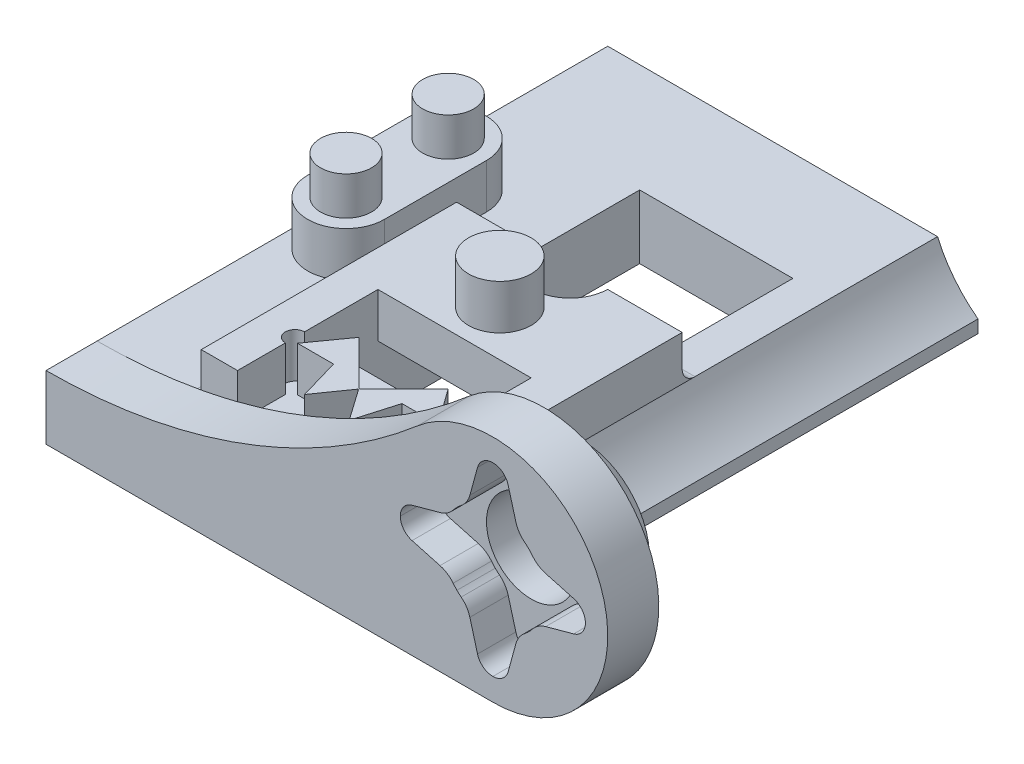
from build123d import *

# Parameters (mm, degrees)
SKETCH1_R           = 9
BOSS_EXTRUDE1_DEPTH = 4
SKETCH2_R           = 7
BOSS_EXTRUDE2_DEPTH = 3
BOSS_EXTRUDE2_TAPER = 30
CUT_EXTRUDE1_DEPTH  = 3
BOSS_EXTRUDE3_DEPTH = 40
SKETCH6_W           = 12
SKETCH6_H           = 23
CUT_EXTRUDE2_DEPTH  = 55.717456081
BOSS_EXTRUDE4_DEPTH = 3.5
SKETCH8_R           = 2
BOSS_EXTRUDE5_DEPTH = 3
SKETCH9_R           = 3.5
CUT_EXTRUDE3_DEPTH  = 52.720402164
BOSS_EXTRUDE6_DEPTH = 3.5
SKETCH11_R          = 2.45
BOSS_EXTRUDE7_DEPTH = 3.5
BOSS_EXTRUDE8_DEPTH = 3.5
FILLET3_START       = -26.84
FILLET3_DEPTH       = 2.84
FILLET3_START_2     = -12
FILLET3_2_DEPTH     = 2.83
FILLET3_START_3     = -21
FILLET3_3_DEPTH     = 21
FILLET3_START_4     = -27.84
FILLET3_4_DEPTH     = 1


with BuildPart() as part:
    # Sketch1 → Boss-Extrude1 (new body)
    with BuildSketch(Plane.XY):
        with BuildLine():
            Line((-35, -9), (0, -9))
            ThreePointArc((0, -9), (-8.437416666, -3.132091953), (-5.872614409, 6.82))
            ThreePointArc((-5.872614409, 6.82), (-19.465199243, -1.204217751), (-35, -4))
            Line((-35, -4), (-35, -9))
        make_face()
        Circle(SKETCH1_R)
    extrude(amount=BOSS_EXTRUDE1_DEPTH)

    # Sketch2 → Boss-Extrude2 (add)
    with BuildSketch(Plane(origin=(0, 0, 0), x_dir=(-1, 0, 0), z_dir=(0, 0, -1))):
        Circle(SKETCH2_R)
    extrude(amount=BOSS_EXTRUDE2_DEPTH, taper=BOSS_EXTRUDE2_TAPER)

    # Sketch4 → Cut-Extrude1 (cut)
    with BuildSketch(Plane.XY.offset(4)):
        with BuildLine():
            Line((1.2, -6.33), (1.8, -4.1378116))
            ThreePointArc((1.8, -4.1378116), (2.058560194, -3.569045514), (2.48, -3.1078116))
            ThreePointArc((2.48, -3.1078116), (2.64989874, -2.964295475), (2.811558399, -2.811558399))
            ThreePointArc((2.811558399, -2.811558399), (2.964295475, -2.64989874), (3.1078116, -2.48))
            ThreePointArc((3.1078116, -2.48), (3.569045514, -2.058560194), (4.1378116, -1.8))
            Line((4.1378116, -1.8), (6.33, -1.2))
            ThreePointArc((6.33, -1.2), (6.992020752, -0.754882576), (7.25, 0))
            ThreePointArc((7.25, 0), (6.992020752, 0.754882576), (6.33, 1.2))
            Line((6.33, 1.2), (4.1378116, 1.8))
            ThreePointArc((4.1378116, 1.8), (3.569045514, 2.058560194), (3.1078116, 2.48))
            ThreePointArc((3.1078116, 2.48), (2.964295475, 2.64989874), (2.811558399, 2.811558399))
            ThreePointArc((2.811558399, 2.811558399), (2.64989874, 2.964295475), (2.48, 3.1078116))
            ThreePointArc((2.48, 3.1078116), (2.058560194, 3.569045514), (1.8, 4.1378116))
            Line((1.8, 4.1378116), (1.2, 6.33))
            ThreePointArc((1.2, 6.33), (0.754882576, 6.992020752), (0, 7.25))
            ThreePointArc((0, 7.25), (-0.754882576, 6.992020752), (-1.2, 6.33))
            Line((-1.2, 6.33), (-1.8, 4.1378116))
            ThreePointArc((-1.8, 4.1378116), (-2.058560194, 3.569045514), (-2.48, 3.1078116))
            ThreePointArc((-2.48, 3.1078116), (-2.64989874, 2.964295475), (-2.811558399, 2.811558399))
            ThreePointArc((-2.811558399, 2.811558399), (-2.964295475, 2.64989874), (-3.1078116, 2.48))
            ThreePointArc((-3.1078116, 2.48), (-3.569045514, 2.058560194), (-4.1378116, 1.8))
            Line((-4.1378116, 1.8), (-6.33, 1.2))
            ThreePointArc((-6.33, 1.2), (-6.992020752, 0.754882576), (-7.25, 0))
            ThreePointArc((-7.25, 0), (-6.992020752, -0.754882576), (-6.33, -1.2))
            Line((-6.33, -1.2), (-4.1378116, -1.8))
            ThreePointArc((-4.1378116, -1.8), (-3.569045514, -2.058560194), (-3.1078116, -2.48))
            ThreePointArc((-3.1078116, -2.48), (-2.964295475, -2.64989874), (-2.811558399, -2.811558399))
            ThreePointArc((-2.811558399, -2.811558399), (-2.64989874, -2.964295475), (-2.48, -3.1078116))
            ThreePointArc((-2.48, -3.1078116), (-2.058560194, -3.569045514), (-1.8, -4.1378116))
            Line((-1.8, -4.1378116), (-1.2, -6.33))
            ThreePointArc((-1.2, -6.33), (-0.754882576, -6.992020752), (0, -7.25))
            ThreePointArc((0, -7.25), (0.754882576, -6.992020752), (1.2, -6.33))
        make_face()
    extrude(amount=-CUT_EXTRUDE1_DEPTH, mode=Mode.SUBTRACT)

    # Sketch5 → Boss-Extrude3 (add)
    with BuildSketch(Plane(origin=(0, 0, 0), x_dir=(-1, 0, 0), z_dir=(0, 0, -1))):
        with BuildLine():
            Line((35, -9), (35, -4))
            Line((35, -4), (9.17, -4))
            ThreePointArc((9.17, -4), (7.844486312, -6.205642902), (6, -8))
            Line((6, -8), (6, -9))
            Line((6, -9), (35, -9))
        make_face()
    extrude(amount=BOSS_EXTRUDE3_DEPTH)

    # Sketch6 → Cut-Extrude2 (cut, through all)
    with BuildSketch(Plane(origin=(0, -4, 0), x_dir=(1, 0, 0), z_dir=(0, 1, 0))):
        with Locations((-18, 20)):
            Rectangle(SKETCH6_W, SKETCH6_H)
    extrude(amount=-CUT_EXTRUDE2_DEPTH, mode=Mode.SUBTRACT)

    # Sketch7 → Boss-Extrude4 (add)
    with BuildSketch(Plane(origin=(0, -4, 0), x_dir=(1, 0, 0), z_dir=(0, 1, 0))):
        with BuildLine():
            Line((-28.5, 24), (-28.5, 16))
            ThreePointArc((-28.5, 16), (-31.5, 13), (-34.5, 16))
            Line((-34.5, 16), (-34.5, 24))
            ThreePointArc((-34.5, 24), (-31.5, 27), (-28.5, 24))
        make_face()
    extrude(amount=BOSS_EXTRUDE4_DEPTH)

    # Sketch8 → Boss-Extrude5 (add)
    with BuildSketch(Plane(origin=(0, -0.5, 0), x_dir=(1, 0, 0), z_dir=(0, 1, 0))):
        with Locations(Location((-31.5, 24, 0), (0, 0, 180))):
            Circle(SKETCH8_R)
        with Locations((-31.5, 16)):
            Circle(SKETCH8_R)
    extrude(amount=BOSS_EXTRUDE5_DEPTH)

    # Sketch9 → Cut-Extrude3 (cut, through all)
    with BuildSketch(Plane(origin=(0, 0, -3), x_dir=(-1, 0, 0), z_dir=(0, 0, -1))):
        Circle(SKETCH9_R)
    extrude(amount=-CUT_EXTRUDE3_DEPTH, mode=Mode.SUBTRACT)

    # Sketch10 → Boss-Extrude6 (add)
    with BuildSketch(Plane(origin=(0, -4, 0), x_dir=(1, 0, 0), z_dir=(0, 1, 0))):
        with BuildLine():
            Line((-26.84, 0), (-26.84, 20))
            Line((-26.84, 20), (-21.01, 20))
            ThreePointArc((-21.01, 20), (-18.010462475, 17.05267484), (-15.010924951, 20))
            Line((-15.010924951, 20), (-9.17, 20))
            Line((-9.17, 20), (-9.17, 0))
            Line((-9.17, 0), (-12, 0))
            Line((-12, 0), (-12, 3.75))
            ThreePointArc((-12, 3.75), (-11.25, 4.5), (-12, 5.25))
            Line((-12, 5.25), (-12, 11))
            Line((-12, 11), (-24, 11))
            Line((-24, 11), (-24, 5.25))
            ThreePointArc((-24, 5.25), (-24.75, 4.5), (-24, 3.75))
            Line((-24, 3.75), (-24, 0))
            Line((-24, 0), (-26.84, 0))
        make_face()
    extrude(amount=BOSS_EXTRUDE6_DEPTH)

    # Sketch11 → Boss-Extrude7 (add)
    with BuildSketch(Plane(origin=(0, -0.5, 0), x_dir=(1, 0, 0), z_dir=(0, 1, 0))):
        with Locations(Location((-18.006141049, 14.55267484, 0), (0, 0, 180))):
            Circle(SKETCH11_R)
    extrude(amount=BOSS_EXTRUDE7_DEPTH)

    # Sketch12 → Boss-Extrude8 (add)
    with BuildSketch(Plane(origin=(0, -4, 0), x_dir=(1, 0, 0), z_dir=(0, 1, 0))):
        Polygon((-20.68, 4.2), (-23.5, 4.2), (-21.5, 7), (-18.05, 3.55), (-17.95, 3.55), (-14.5, 7), (-12.5, 4.2), (-15.32, 4.2), (-16.25, 1), (-17.97, 3.45), (-18.03, 3.45), (-19.75, 1), align=None)
    extrude(amount=BOSS_EXTRUDE8_DEPTH)

    # Fillet3: read off the stored shape, not the designer's step
    # Fillet3 outline → Fillet3 (add)
    with BuildSketch(Plane.YZ.offset(FILLET3_START)):
        with BuildLine():
            ThreePointArc((-4, -21), (-3.707106781, -20.292893219), (-3, -20))
            Line((-3, -20), (-4, -20))
            Line((-4, -20), (-4, -21))
        make_face()
    extrude(amount=FILLET3_DEPTH)

    # Fillet3 2 outline → Fillet3 2 (add)
    with BuildSketch(Plane.YZ.offset(FILLET3_START_2)):
        with BuildLine():
            ThreePointArc((-4, -21), (-3.707106781, -20.292893219), (-3, -20))
            Line((-3, -20), (-4, -20))
            Line((-4, -20), (-4, -21))
        make_face()
    extrude(amount=FILLET3_2_DEPTH)

    # Fillet3 3 outline → Fillet3 3 (add)
    with BuildSketch(Plane.XY.offset(FILLET3_START_3)):
        with BuildLine():
            Line((-26.84, -4), (-26.84, -3))
            ThreePointArc((-26.84, -3), (-27.132893219, -3.707106781), (-27.84, -4))
            Line((-27.84, -4), (-26.84, -4))
        make_face()
    extrude(amount=FILLET3_3_DEPTH)

    # Fillet3 4 outline → Fillet3 4 (cut)
    with BuildSketch(Plane.YZ.offset(FILLET3_START_4)):
        with BuildLine():
            Line((-2, -19.999999999), (-3, -20))
            ThreePointArc((-3, -20), (-3.707106781, -20.292893219), (-4, -21))
            Line((-4, -21), (-2, -21))
            Line((-2, -21), (-2, -19.999999999))
        make_face()
    extrude(amount=FILLET3_4_DEPTH, mode=Mode.SUBTRACT)


solid = part.part
